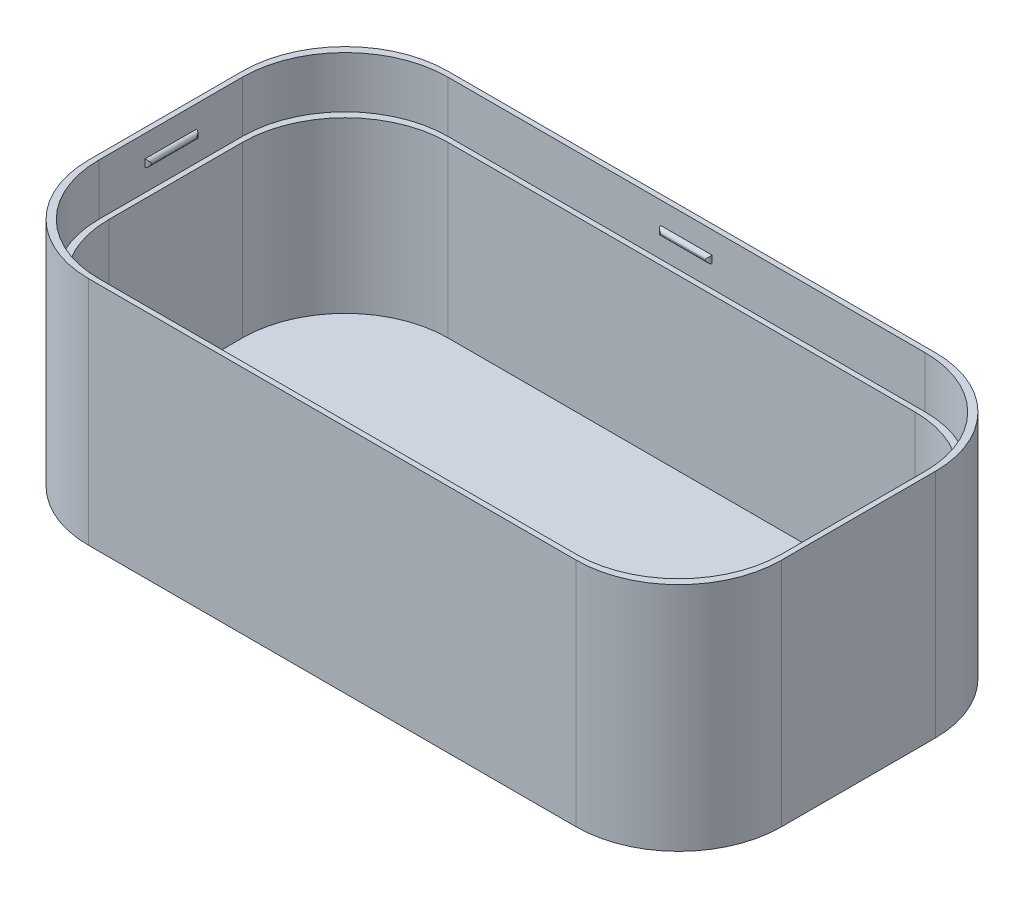
from build123d import *

# Parameters (mm, degrees)
SKETCH_1_W             = 135
SKETCH_1_H             = 70
EXTRUDE_1_DEPTH        = 45
SKETCH_2_W             = 133
SKETCH_2_H             = 68
CUT_EXTRUDE_1_DEPTH    = 10
SKETCH_4_W             = 131
SKETCH_4_H             = 66
CUT_EXTRUDE_3_DEPTH    = 33
FILLET_3_R             = 20
SKETCH_5_W             = 10
SKETCH_5_H             = 1.4
EXTRUDE_2_DEPTH        = 0.7
FILLET_5_R             = 0.7
FILLET_5_OF_MIRROR_2_R = 0.7
SKETCH_6_W             = 10
SKETCH_6_H             = 1.4
EXTRUDE_3_DEPTH        = 0.7
FILLET_6_R             = 0.7
FILLET_6_OF_MIRROR_3_R = 0.7


with BuildPart() as part:
    # 草图1 → 凸台-拉伸1 (new body)
    with BuildSketch(Plane(origin=(0, 0, 0), x_dir=(1, 0, 0), z_dir=(0, 1, 0))):
        Rectangle(SKETCH_1_W, SKETCH_1_H)
    extrude(amount=EXTRUDE_1_DEPTH)

    # 草图2 → 切除-拉伸1 (cut)
    with BuildSketch(Plane(origin=(0, 45, 0), x_dir=(1, 0, 0), z_dir=(0, 1, 0))):
        Rectangle(SKETCH_2_W, SKETCH_2_H)
    extrude(amount=-CUT_EXTRUDE_1_DEPTH, mode=Mode.SUBTRACT)

    # 草图4 → 切除-拉伸3 (cut)
    with BuildSketch(Plane(origin=(0, 35, 0), x_dir=(1, 0, 0), z_dir=(0, 1, 0))):
        Rectangle(SKETCH_4_W, SKETCH_4_H)
    extrude(amount=-CUT_EXTRUDE_3_DEPTH, mode=Mode.SUBTRACT)

    # 圆角3
    fillet_3_edges = [part.edges().sort_by_distance(p)[0] for p in [
        (-66.5, 40, -34),
        (66.5, 40, -34),
        (66.5, 40, 34),
        (-66.5, 40, 34),
        (65.5, 18.5, -33),
        (-65.5, 18.5, -33),
        (-65.5, 18.5, 33),
        (65.5, 18.5, 33),
        (-67.5, 22.5, 35),
        (67.5, 22.5, 35),
        (67.5, 22.5, -35),
        (-67.5, 22.5, -35),
    ]]
    fillet(fillet_3_edges, radius=FILLET_3_R)

    # 草图5 → 凸台-拉伸2 (add)
    with BuildSketch(Plane.XY.offset(-34)):
        with Locations((0, 40)):
            Rectangle(SKETCH_5_W, SKETCH_5_H)
    extrude_2 = extrude(amount=EXTRUDE_2_DEPTH)

    # 圆角5
    fillet_5_edges = [part.edges().sort_by_distance(p)[0] for p in [
        (5, 40, -33.3),
        (-5, 40, -33.3),
        (0, 39.3, -33.3),
        (0, 40.7, -33.3),
    ]]
    fillet(fillet_5_edges, radius=FILLET_5_R - 0.0001)  # a hair under: the kernel refuses the full size

    # 镜向2: 凸台-拉伸2 across plane
    add(extrude_2.mirror(Plane.XY))

    # 圆角5 of 镜向2
    fillet_5_of_mirror_2_edges = [part.edges().sort_by_distance(p)[0] for p in [
        (5, 40, 33.3),
        (-5, 40, 33.3),
        (0, 39.3, 33.3),
        (0, 40.7, 33.3),
    ]]
    fillet(fillet_5_of_mirror_2_edges, radius=FILLET_5_OF_MIRROR_2_R - 0.0001)  # a hair under: the kernel refuses the full size

    # 草图6 → 凸台-拉伸3 (add)
    with BuildSketch(Plane(origin=(-66.5, 0, 0), x_dir=(0, 0, -1), z_dir=(1, 0, 0))):
        with Locations((0, 40)):
            Rectangle(SKETCH_6_W, SKETCH_6_H)
    extrude_3 = extrude(amount=EXTRUDE_3_DEPTH)

    # 圆角6
    fillet_6_edges = [part.edges().sort_by_distance(p)[0] for p in [
        (-65.8, 40, -5),
        (-65.8, 40, 5),
        (-65.8, 39.3, 0),
        (-65.8, 40.7, 0),
    ]]
    fillet(fillet_6_edges, radius=FILLET_6_R - 0.0001)  # a hair under: the kernel refuses the full size

    # 镜向3: 凸台-拉伸3 across plane
    add(extrude_3.mirror(Plane(origin=(0, 0, 0), x_dir=(0, 0, 1), z_dir=(1, 0, 0))))

    # 圆角6 of 镜向3
    fillet_6_of_mirror_3_edges = [part.edges().sort_by_distance(p)[0] for p in [
        (65.8, 40, -5),
        (65.8, 40, 5),
        (65.8, 39.3, 0),
        (65.8, 40.7, 0),
    ]]
    fillet(fillet_6_of_mirror_3_edges, radius=FILLET_6_OF_MIRROR_3_R - 0.0001)  # a hair under: the kernel refuses the full size


solid = part.part
